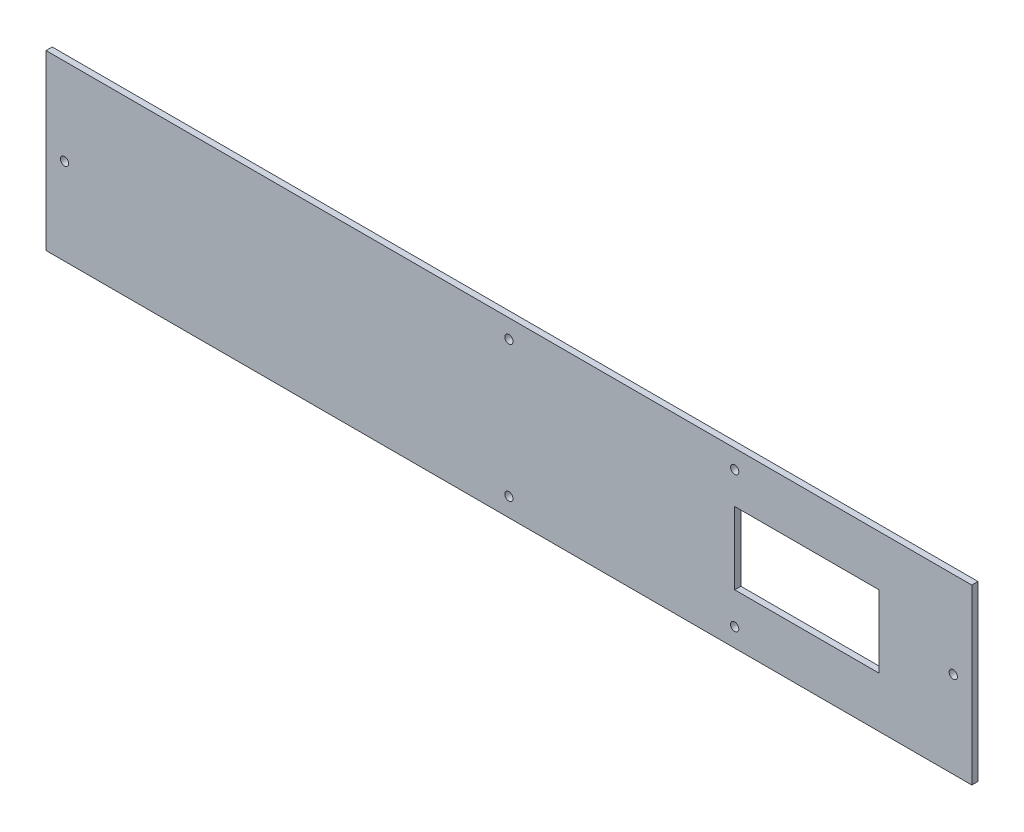
from build123d import *

# Parameters (mm, degrees)
SKETCH_F_W                   = 449
SKETCH_F_H                   = 84
SKETCH_F_R                   = 2
SKETCH_F_W_2                 = 70
SKETCH_F_H_2                 = 35
ESTRUSIONE_ESTRUSIONE1_DEPTH = 3


with BuildPart() as part:
    # Sketch f → Estrusione-Estrusione1 (new body)
    with BuildSketch(Plane.XY):
        with Locations((224.5, 42)):
            Rectangle(SKETCH_F_W, SKETCH_F_H)
        with Locations((9, 42)):
            Circle(SKETCH_F_R, mode=Mode.SUBTRACT)
        with Locations((224.5, 75)):
            Circle(SKETCH_F_R, mode=Mode.SUBTRACT)
        with Locations((224.5, 9)):
            Circle(SKETCH_F_R, mode=Mode.SUBTRACT)
        with Locations((440, 42)):
            Circle(SKETCH_F_R, mode=Mode.SUBTRACT)
        with Locations((334, 75)):
            Circle(SKETCH_F_R, mode=Mode.SUBTRACT)
        with Locations((334, 9)):
            Circle(SKETCH_F_R, mode=Mode.SUBTRACT)
        with Locations((369, 42)):
            Rectangle(SKETCH_F_W_2, SKETCH_F_H_2, mode=Mode.SUBTRACT)
    extrude(amount=ESTRUSIONE_ESTRUSIONE1_DEPTH)


solid = part.part
